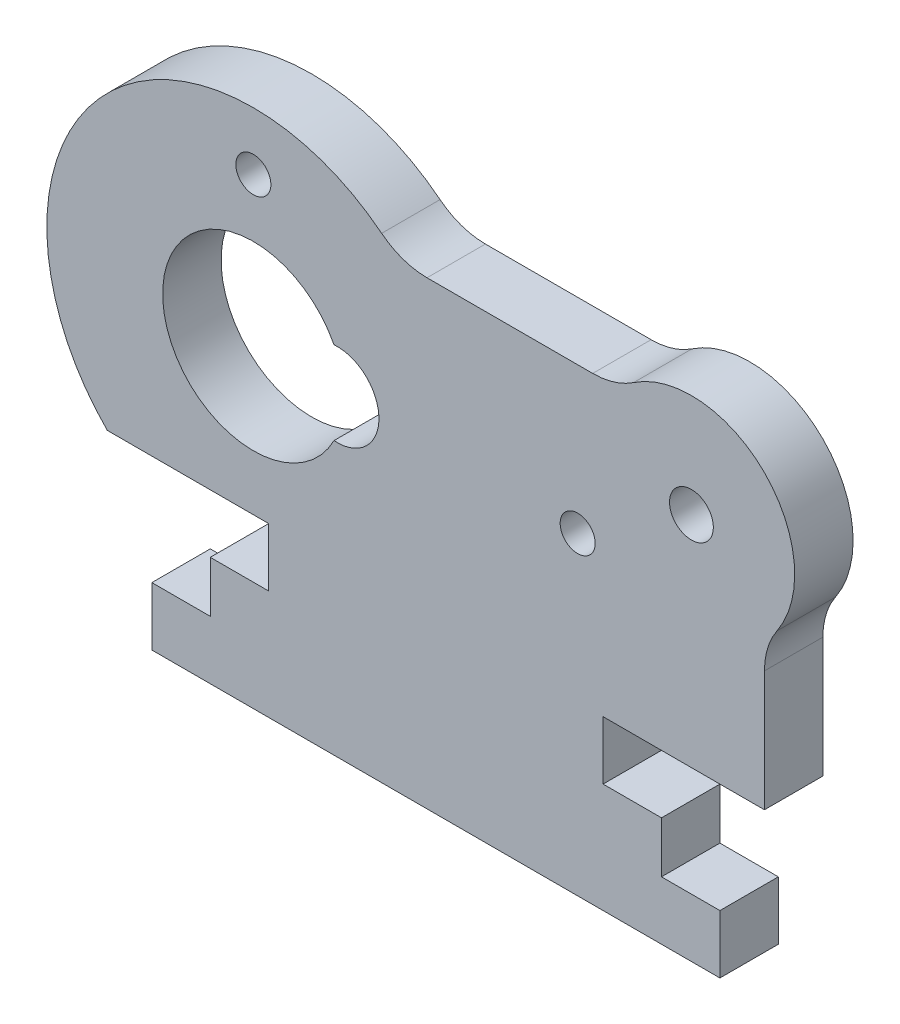
from build123d import *

# Parameters (mm, degrees)
SKETCH2_R           = 1.2
SKETCH2_R_2         = 1.5
BOSS_EXTRUDE1_DEPTH = 4
FILLET1_R           = 5


with BuildPart() as part:
    # Sketch2 → Boss-Extrude1 (new body)
    with BuildSketch(Plane.XY):
        with BuildLine():
            Line((0, 4), (0, 0))
            Line((0, 0), (38.9, 0))
            Line((38.9, 0), (38.9, 4))
            Line((38.9, 4), (34.9, 4))
            Line((34.9, 4), (34.9, 7.5))
            Line((34.9, 7.5), (30.9, 7.5))
            Line((30.9, 7.5), (30.9, 11.5))
            Line((30.9, 11.5), (41.95, 11.5))
            Line((41.95, 11.5), (41.95, 21.5))
            ThreePointArc((41.95, 21.5), (41.95, 31.5), (31.95, 31.5))
            Line((31.95, 31.5), (16.95, 31.5))
            ThreePointArc((16.95, 31.5), (-3.05, 31.5), (-3.05, 11.5))
            Line((-3.05, 11.5), (8, 11.5))
            Line((8, 11.5), (8, 7.5))
            Line((8, 7.5), (4, 7.5))
            Line((4, 7.5), (4, 4))
            Line((4, 4), (0, 4))
        make_face()
        with Locations((29.16, 21.5)):
            Circle(SKETCH2_R, mode=Mode.SUBTRACT)
        with Locations((6.95, 31.676067812)):
            Circle(SKETCH2_R, mode=Mode.SUBTRACT)
        with Locations((36.95, 26.5)):
            Circle(SKETCH2_R_2, mode=Mode.SUBTRACT)
        with BuildLine():
            ThreePointArc((12.472095652, 24.340873036), (15.55, 21.5), (12.472095652, 18.659126964))
            ThreePointArc((12.472095652, 18.659126964), (0.74, 21.5), (12.472095652, 24.340873036))
        make_face(mode=Mode.SUBTRACT)
    extrude(amount=BOSS_EXTRUDE1_DEPTH)

    # Fillet1
    fillet1_edges = [part.edges().sort_by_distance(p)[0] for p in [
        (41.95, 21.5, 2),
        (31.95, 31.5, 2),
        (16.95, 31.5, 2),
    ]]
    fillet(fillet1_edges, radius=FILLET1_R)


solid = part.part
